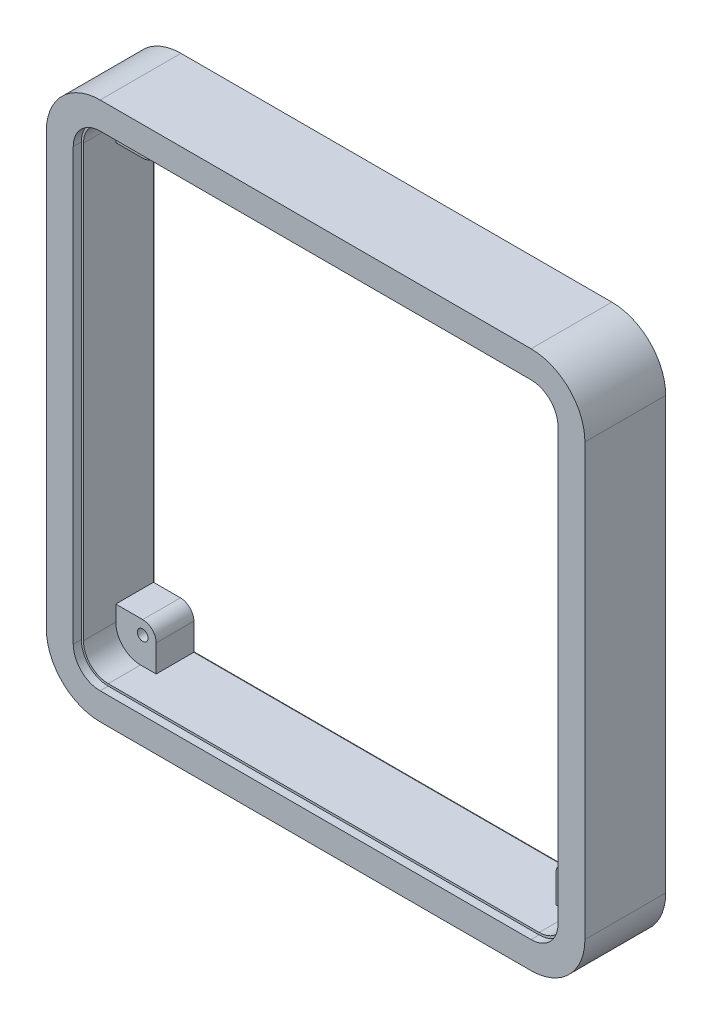
from build123d import *

# Parameters (mm, degrees)
SKETCH2_W                = 200
SKETCH2_H                = 200
BOSS_EXTRUDE1_DEPTH      = 30
FILLET1_R                = 20
CUT_EXTRUDE1_DEPTH       = 3
CUT_EXTRUDE2_DEPTH       = 144.975692393
SKETCH6_W                = 15
SKETCH6_H                = 15
BOSS_EXTRUDE4_DEPTH      = 15
FILLET2_R                = 5
F_4_0_4_DIAMETER_HOLE1_D = 4
CUT_EXTRUDE3_START       = -1
CUT_EXTRUDE3_DEPTH       = 1


with BuildPart() as part:
    # Sketch2 → Boss-Extrude1 (new body)
    with BuildSketch(Plane.XY):
        Rectangle(SKETCH2_W, SKETCH2_H)
    extrude(amount=BOSS_EXTRUDE1_DEPTH)

    # Fillet1
    fillet1_edges = [part.edges().sort_by_distance(p)[0] for p in [
        (-100, -100, 15),
        (100, -100, 15),
        (100, 100, 15),
        (-100, 100, 15),
    ]]
    fillet(fillet1_edges, radius=FILLET1_R)

    # Sketch3 → Cut-Extrude1 (cut)
    with BuildSketch(Plane.XY.offset(30)):
        with BuildLine():
            Line((-90, 80), (-90, -80))
            ThreePointArc((-90, -80), (-87.071067812, -87.071067812), (-80, -90))
            Line((-80, -90), (80, -90))
            ThreePointArc((80, -90), (87.071067812, -87.071067812), (90, -80))
            Line((90, -80), (90, 80))
            ThreePointArc((90, 80), (87.071067812, 87.071067812), (80, 90))
            Line((80, 90), (-80, 90))
            ThreePointArc((-80, 90), (-87.071067812, 87.071067812), (-90, 80))
        make_face()
    extrude(amount=-CUT_EXTRUDE1_DEPTH, mode=Mode.SUBTRACT)

    # Sketch4 → Cut-Extrude2 (cut, through all)
    with BuildSketch(Plane.XY.offset(27)):
        with BuildLine():
            Line((-89.2, 80), (-89.2, -80))
            ThreePointArc((-89.2, -80), (-86.505382387, -86.505382387), (-80, -89.2))
            Line((-80, -89.2), (80, -89.2))
            ThreePointArc((80, -89.2), (86.505382387, -86.505382387), (89.2, -80))
            Line((89.2, -80), (89.2, 80))
            ThreePointArc((89.2, 80), (86.505382387, 86.505382387), (80, 89.2))
            Line((80, 89.2), (-80, 89.2))
            ThreePointArc((-80, 89.2), (-86.505382387, 86.505382387), (-89.2, 80))
        make_face()
    extrude(amount=-CUT_EXTRUDE2_DEPTH, mode=Mode.SUBTRACT)

    # Sketch6 → Boss-Extrude4 (add)
    with BuildSketch(Plane(origin=(0, 0, 0), x_dir=(-1, 0, 0), z_dir=(0, 0, -1))):
        with Locations((-81.7, -81.7)):
            Rectangle(SKETCH6_W, SKETCH6_H)
        with Locations((-81.7, 81.7)):
            Rectangle(SKETCH6_W, SKETCH6_H)
        with Locations((81.7, 81.7)):
            Rectangle(SKETCH6_W, SKETCH6_H)
        with Locations((81.7, -81.7)):
            Rectangle(SKETCH6_W, SKETCH6_H)
    extrude(amount=-BOSS_EXTRUDE4_DEPTH)

    # Fillet2
    fillet2_edges = [part.edges().sort_by_distance(p)[0] for p in [
        (74.2, -74.2, 7.5),
        (-74.2, -74.2, 7.5),
        (-74.2, 74.2, 7.5),
        (74.2, 74.2, 7.5),
    ]]
    fillet(fillet2_edges, radius=FILLET2_R)

    # Ø4.0 (4) Diameter Hole1 (through all)
    with Locations(Plane(origin=(0, 0, 0), x_dir=(-1, 0, 0), z_dir=(0, 0, -1))):
        with Locations((-79.2, 79.2), (79.2, 79.2), (-79.2, -79.2), (79.2, -79.2)):
            Hole(F_4_0_4_DIAMETER_HOLE1_D / 2)

    # Sketch10 → Cut-Extrude3 (cut)
    with BuildSketch(Plane(origin=(0, 0, 0), x_dir=(-1, 0, 0), z_dir=(0, 0, -1)).offset(CUT_EXTRUDE3_START)):
        with BuildLine():
            Line((90, -80), (90, 80))
            ThreePointArc((90, 80), (87.071067812, 87.071067812), (80, 90))
            Line((80, 90), (-80, 90))
            ThreePointArc((-80, 90), (-87.071067812, 87.071067812), (-90, 80))
            Line((-90, 80), (-90, -80))
            ThreePointArc((-90, -80), (-87.071067812, -87.071067812), (-80, -90))
            Line((-80, -90), (80, -90))
            ThreePointArc((80, -90), (87.071067812, -87.071067812), (90, -80))
        make_face()
    extrude(amount=CUT_EXTRUDE3_DEPTH, mode=Mode.SUBTRACT)


solid = part.part
